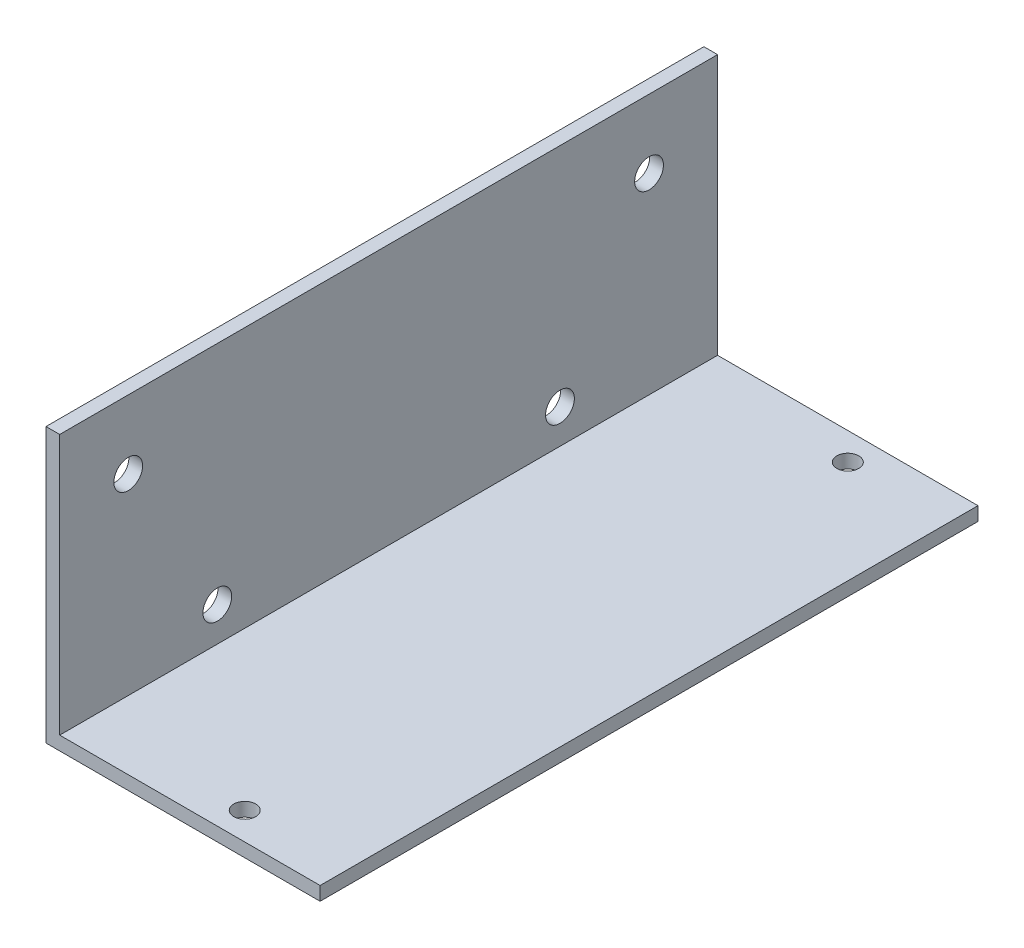
from build123d import *

# Parameters (mm, degrees)
EXTRUDE_1_DEPTH     = 96
SKETCH_2_R          = 1.6
CUT_EXTRUDE_1_DEPTH = 112.427106217
SKETCH_3_R          = 2.1
CUT_EXTRUDE_2_DEPTH = 112.427106217


with BuildPart() as part:
    # Эскиз1 → Бобышка-Вытянуть1 (new body)
    with BuildSketch(Plane.XY):
        Polygon((0, 0), (40, 0), (40, 2), (2, 2), (2, 40), (0, 40), align=None)
    extrude(amount=EXTRUDE_1_DEPTH)

    # Эскиз2 → Вырез-Вытянуть1 (cut, through all)
    with BuildSketch(Plane.XZ):
        with Locations((25, 92)):
            Circle(SKETCH_2_R)
        with Locations((25, 4)):
            Circle(SKETCH_2_R)
    extrude(amount=-CUT_EXTRUDE_1_DEPTH, mode=Mode.SUBTRACT)

    # Эскиз3 → Вырез-Вытянуть2 (cut, through all)
    with BuildSketch(Plane.ZY):
        with Locations((10, 30)):
            Circle(SKETCH_3_R)
        with Locations((86, 30)):
            Circle(SKETCH_3_R)
        with Locations((73, 7)):
            Circle(SKETCH_3_R)
        with Locations((23, 7)):
            Circle(SKETCH_3_R)
    extrude(amount=-CUT_EXTRUDE_2_DEPTH, mode=Mode.SUBTRACT)


solid = part.part
